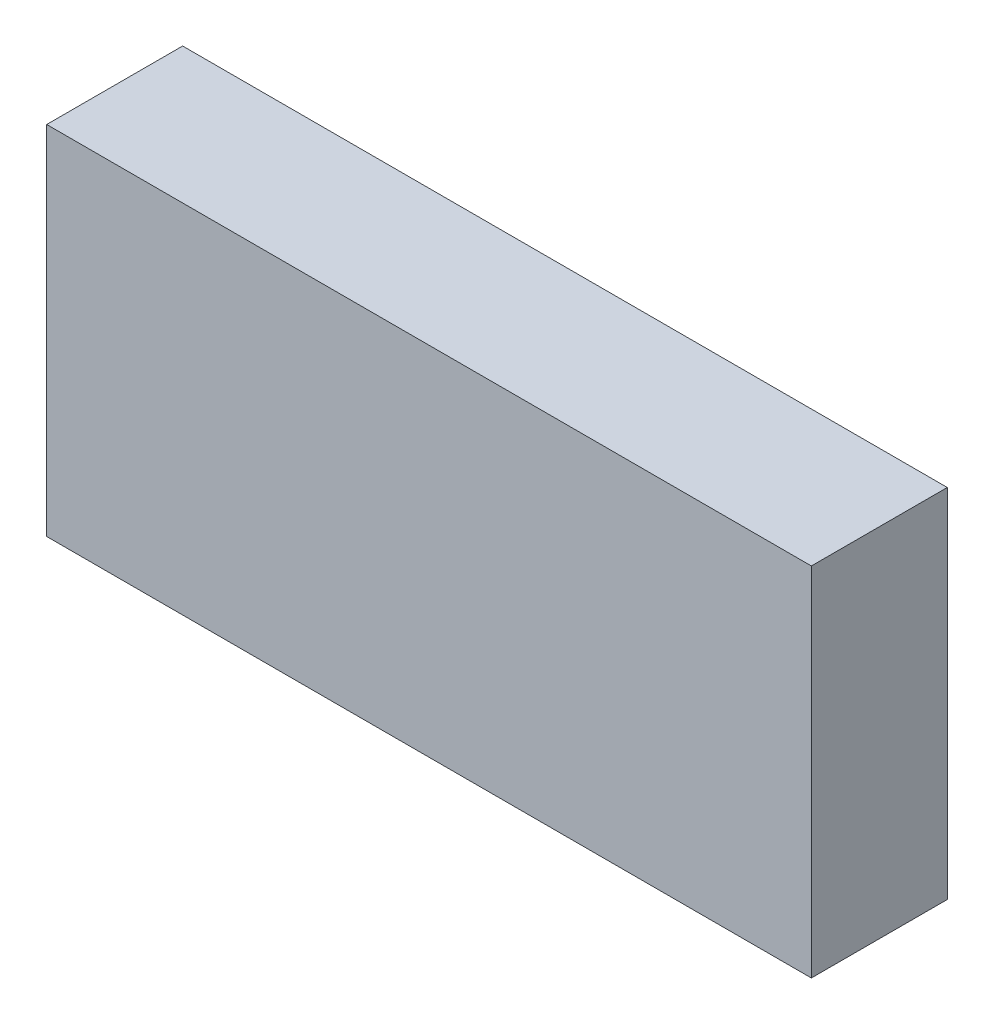
from build123d import *

# Parameters (mm, degrees)
SKETCH1_W           = 45
SKETCH1_H           = 21
BOSS_EXTRUDE1_DEPTH = 8


with BuildPart() as part:
    # Sketch1 → Boss-Extrude1 (new body)
    with BuildSketch(Plane.XY):
        with Locations((22.5, 10.5)):
            Rectangle(SKETCH1_W, SKETCH1_H)
    extrude(amount=BOSS_EXTRUDE1_DEPTH)


solid = part.part
